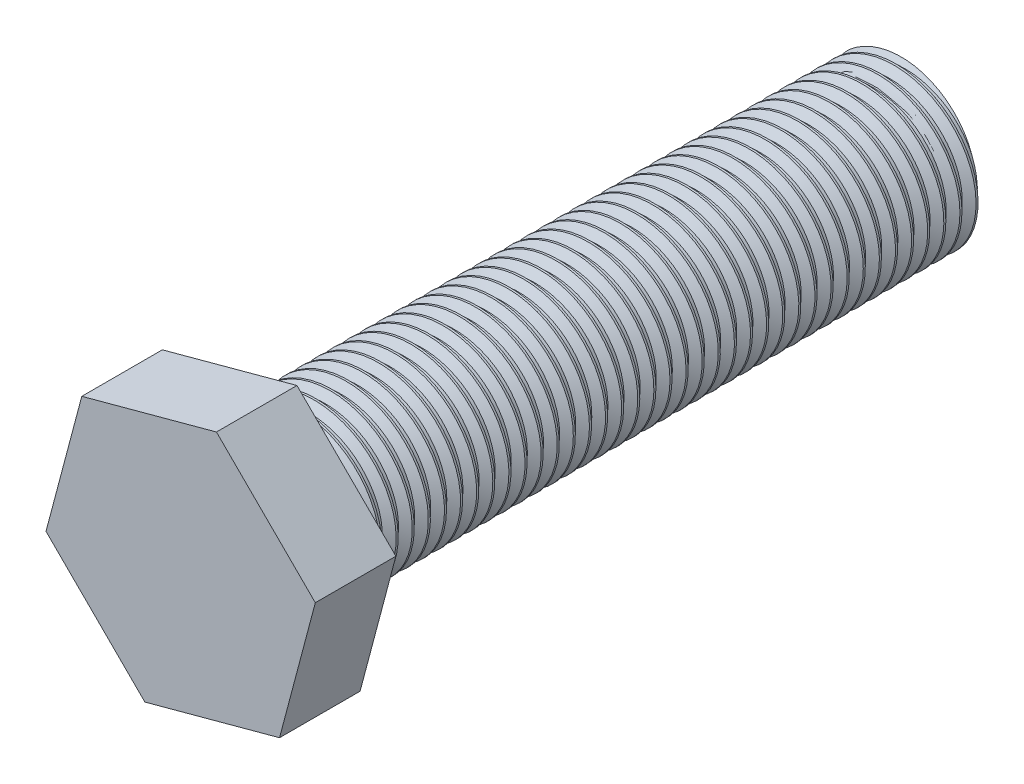
from build123d import *

# Parameters (mm, degrees)
SKETCH1_R           = 6.35
BOSS_EXTRUDE1_DEPTH = 50.8
THREAD1_PITCH       = 1.27
BOSS_EXTRUDE3_DEPTH = 6.35


with BuildPart() as part:
    # Sketch1 → Boss-Extrude1 (new body)
    with BuildSketch(Plane.XY):
        Circle(SKETCH1_R)
    extrude(amount=-BOSS_EXTRUDE1_DEPTH)

    # Thread1: the profile of Thread Profile1 profile screwed along a right-hand helix of 40 turns, 8 arcs to a turn; built about Z, then put on its axis
    thread1_z = Axis((0, 0, 0), (0, 0, 1))
    thread1_corners = [(6.3503, 0, -0.000173205), (6.3503, 0, 1.111423202), (5.662592339, 0, 0.714374998), (5.662592339, 0, 0.396874998)]
    with BuildLine(mode=Mode.PRIVATE) as thread1_profile:
        Line(thread1_corners[0], thread1_corners[1])
        Line(thread1_corners[1], thread1_corners[2])
        Line(thread1_corners[2], thread1_corners[3])
        Line(thread1_corners[3], thread1_corners[0])
    thread1_cap = Face(thread1_profile.wire())
    thread1_turn_angles = [0, 22.5, 45, 67.5, 90, 112.5, 135, 157.5, 180, 202.5, 225, 247.5, 270, 292.5, 315, 337.5, 360, 382.5, 405, 427.5, 450, 472.5, 495, 517.5, 540, 562.5, 585, 607.5, 630, 652.5, 675, 697.5, 720]
    thread1_turn_weights = [1, 0.9238795325112867, 1, 0.9238795325112867, 1, 0.9238795325112867, 1, 0.9238795325112867, 1, 0.9238795325112867, 1, 0.9238795325112867, 1, 0.9238795325112867, 1, 0.9238795325112867, 1, 0.9238795325112867, 1, 0.9238795325112867, 1, 0.9238795325112867, 1, 0.9238795325112867, 1, 0.9238795325112867, 1, 0.9238795325112867, 1, 0.9238795325112867, 1, 0.9238795325112867, 1]
    thread1_turn_rails = [Edge.make_bspline([Vector(p[0], p[1], 0).rotate(thread1_z, thread1_turn_angles[k]) / thread1_turn_weights[k] + Vector(0, 0, p[2] + THREAD1_PITCH * thread1_turn_angles[k] / 360) for k in range(33)], [0, 0, 0, 1, 1, 2, 2, 3, 3, 4, 4, 5, 5, 6, 6, 7, 7, 8, 8, 9, 9, 10, 10, 11, 11, 12, 12, 13, 13, 14, 14, 15, 15, 16, 16, 16], 2, thread1_turn_weights) for p in thread1_corners]
    thread1_turn_sides = [Face.make_surface_from_curves(thread1_turn_rails[p[0]], thread1_turn_rails[p[1]]) for p in [(0, 1), (1, 2), (2, 3), (3, 0)]]
    thread1 = Plane(origin=(0, 0, 0), x_dir=(-1, 0, 0), z_dir=(0, 0, -1)) * Solid(Shell([*[p.moved(Location((0, 0, 2 * THREAD1_PITCH * i))) for i in range(20) for p in thread1_turn_sides], thread1_cap, thread1_cap.rotate(thread1_z, 14400).moved(Location((0, 0, THREAD1_PITCH * 14400 / 360)))]))
    add(thread1, mode=Mode.SUBTRACT)

    # Sketch8 → Boss-Extrude3 (add)
    with BuildSketch(Plane.XY):
        Polygon((10.616922246, 2.872013582), (2.821224401, 10.630531166), (-7.795697845, 7.758517584), (-10.616922246, -2.872013582), (-2.821224401, -10.630531166), (7.795697845, -7.758517584), align=None)
    extrude(amount=BOSS_EXTRUDE3_DEPTH)


solid = part.part
